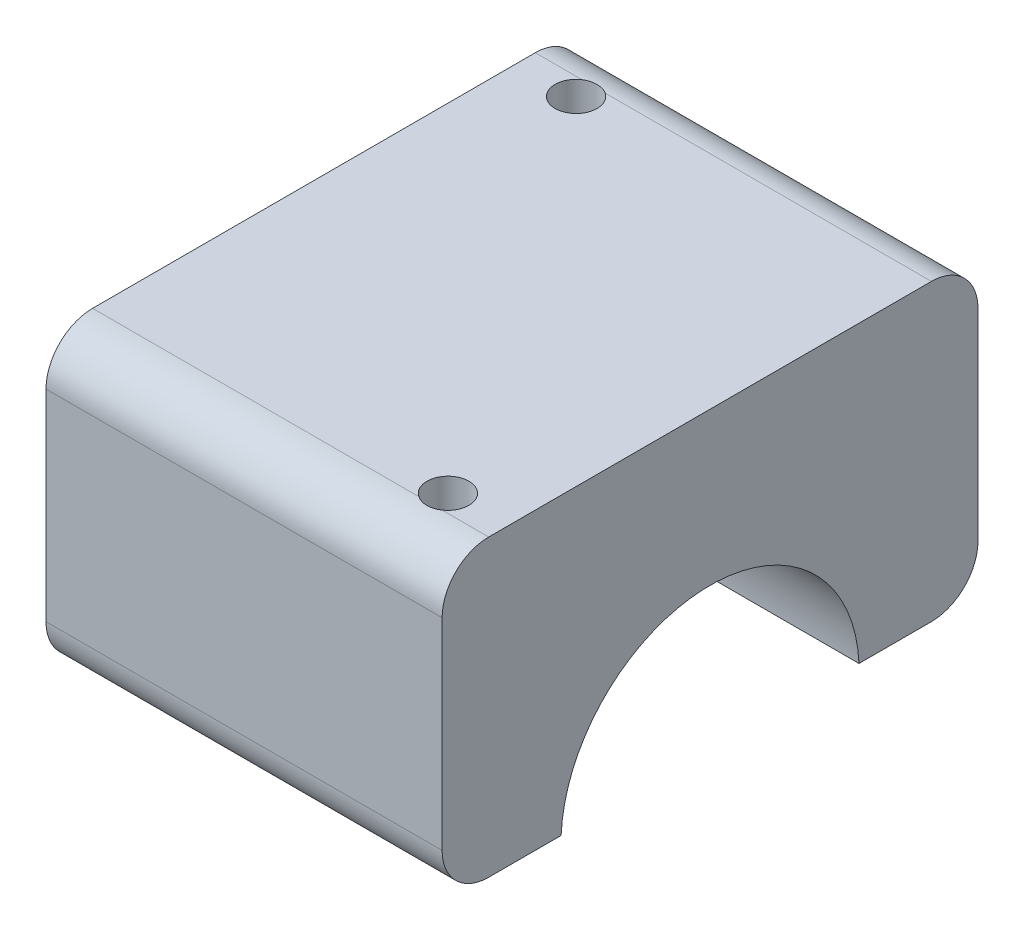
from build123d import *

# Parameters (mm, degrees)
BOSS_EXTRUDE1_DEPTH     = 17
CUT_EXTRUDE1_DEPTH      = 39.582415891
CUT_EXTRUDE1_DEPTH_BACK = 39.582415891
SKETCH2_R               = 12.8
SKETCH3_R               = 1.8
CUT_EXTRUDE2_DEPTH      = 25.896


with BuildPart() as part:
    # Sketch1 → Boss-Extrude1 (new, symmetric)
    with BuildSketch(Plane(origin=(0, 0, 0), x_dir=(0, 0, -1), z_dir=(1, 0, 0))):
        with BuildLine():
            Line((-19, 0.6), (19, 0.6))
            ThreePointArc((19, 0.6), (21.828427125, 1.771572875), (23, 4.6))
            Line((23, 4.6), (23, 21.896))
            ThreePointArc((23, 21.896), (21.828427125, 24.724427125), (19, 25.896))
            Line((19, 25.896), (-19, 25.896))
            ThreePointArc((-19, 25.896), (-21.828427125, 24.724427125), (-23, 21.896))
            Line((-23, 21.896), (-23, 4.6))
            ThreePointArc((-23, 4.6), (-21.828427125, 1.771572875), (-19, 0.6))
        make_face()
    extrude(amount=BOSS_EXTRUDE1_DEPTH, both=True)

    # Sketch2 → Cut-Extrude1 (cut, two sides: drawn at the far end of the back side and taken through both)
    with BuildSketch(Plane(origin=(0, 0, 0), x_dir=(0, 0, -1), z_dir=(1, 0, 0)).offset(-CUT_EXTRUDE1_DEPTH_BACK)):
        Circle(SKETCH2_R)
    extrude(amount=CUT_EXTRUDE1_DEPTH + CUT_EXTRUDE1_DEPTH_BACK, mode=Mode.SUBTRACT)

    # Sketch3 → Cut-Extrude2 (cut)
    with BuildSketch(Plane(origin=(0, 0.6, 0), x_dir=(1, 0, 0), z_dir=(0, 1, 0))):
        with Locations((12, -17.5)):
            Circle(SKETCH3_R)
        with Locations((-12, 17.5)):
            Circle(SKETCH3_R)
    extrude(amount=CUT_EXTRUDE2_DEPTH, mode=Mode.SUBTRACT)


solid = part.part
